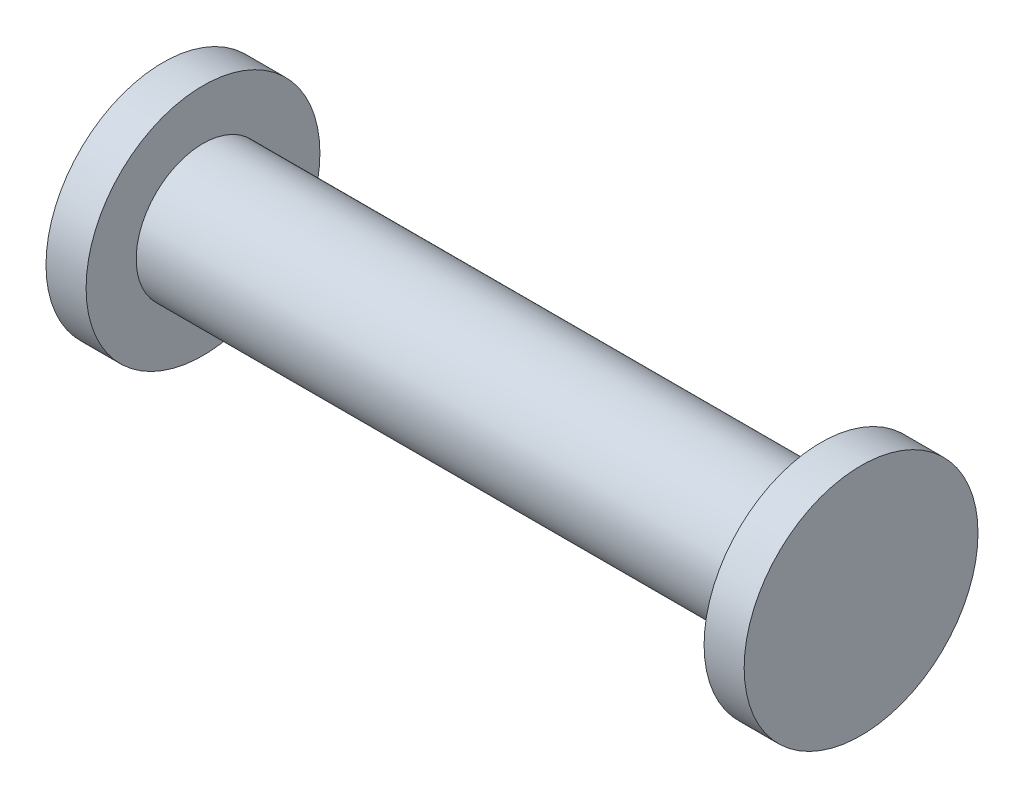
from build123d import *

# Parameters (mm, degrees)
SKETCH_1_R           = 2
F_01_SHAFT_D4_DEPTH  = 9.25
SKETCH_2_R           = 3.5
F_02_HEAD_D7_R_DEPTH = 1.2
F_02_HEAD_D7_L_START = -1.2
SKETCH_3_R           = 3.5
F_02_HEAD_D7_L_DEPTH = 1.2


with BuildPart() as part:
    # 草图1 → 01_SHAFT_D4 (new, symmetric)
    with BuildSketch(Plane(origin=(0, 0, 0), x_dir=(0, 0, -1), z_dir=(1, 0, 0))):
        Circle(SKETCH_1_R)
    extrude(amount=F_01_SHAFT_D4_DEPTH, both=True)

    # 草图2 → 02_HEAD_D7_R (add)
    with BuildSketch(Plane(origin=(9.25, 0, 0), x_dir=(0, 0, -1), z_dir=(1, 0, 0))):
        Circle(SKETCH_2_R)
    extrude(amount=F_02_HEAD_D7_R_DEPTH)

    # 草图3 → 02_HEAD_D7_L (add)
    with BuildSketch(Plane(origin=(-9.25, 0, 0), x_dir=(0, 0, -1), z_dir=(1, 0, 0)).offset(F_02_HEAD_D7_L_START)):
        Circle(SKETCH_3_R)
    extrude(amount=F_02_HEAD_D7_L_DEPTH)


solid = part.part
